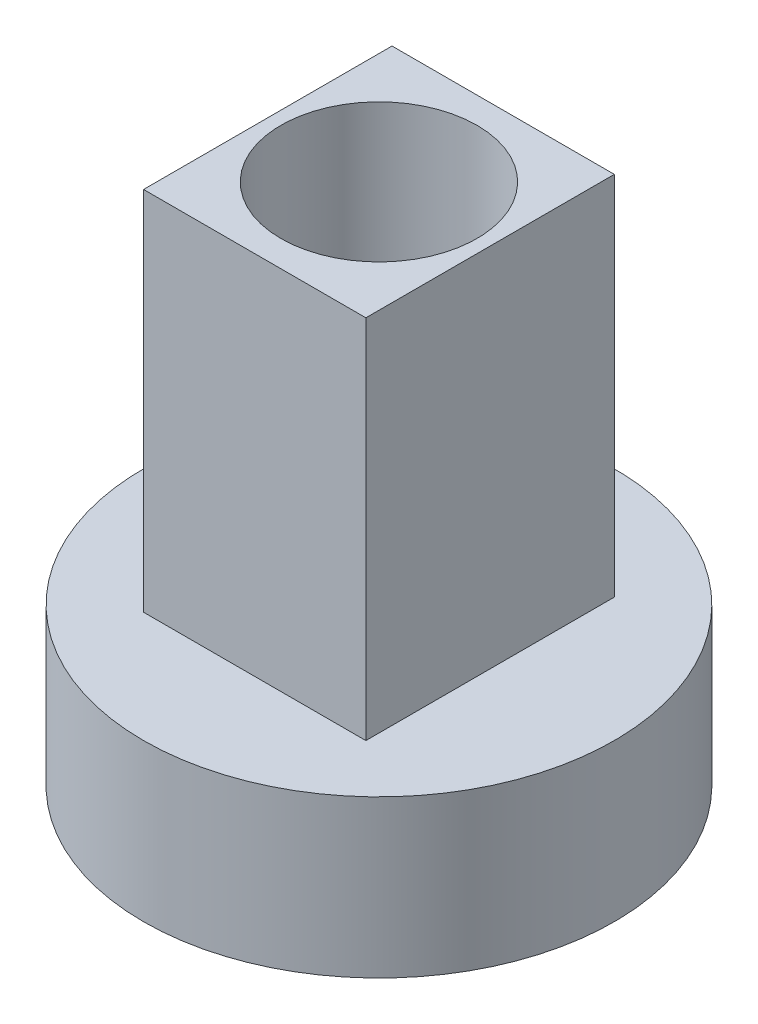
from build123d import *
from build123d.topology import SkipClean

# Parameters (mm, degrees)
SKETCH_2_R            = 90
EXTRUDE_322_DEPTH     = 60
SKETCH_4_W            = 85
SKETCH_4_H            = 95
EXTRUDE_427_DEPTH     = 140
SKETCH_5_R            = 37.5
CUT_EXTRUDE_549_DEPTH = 238.065391823
SHELL_596_OUTLINE_R   = 87
SHELL_596_OUTLINE_R_2 = 40.5
SHELL_596_DEPTH       = 57
SHELL_START           = 57
SHELL_596_2_DEPTH     = 140


# Read off the part's stored shape, not the designer's step: Оболочка
with BuildPart() as part:
    # Эскиз2 → Extrude 322 (new body)
    with BuildSketch(Plane(origin=(0, 0, 0), x_dir=(1, 0, 0), z_dir=(0, 1, 0))):
        with Locations(Location((0, 0, 0), (0, 0, 270))):
            Circle(SKETCH_2_R)
    extrude(amount=EXTRUDE_322_DEPTH)

    # Эскиз4 → Extrude 427 (add)
    with BuildSketch(Plane(origin=(0, 60, 0), x_dir=(1, 0, 0), z_dir=(0, 1, 0))):
        Rectangle(SKETCH_4_W, SKETCH_4_H)
    extrude(amount=EXTRUDE_427_DEPTH)

    # Эскиз5 → Cut-Extrude 549 (cut, through all)
    with BuildSketch(Plane(origin=(0, 200, 0), x_dir=(1, 0, 0), z_dir=(0, 1, 0))):
        with Locations(Location((0, 0, 0), (0, 0, 270))):
            Circle(SKETCH_5_R)
    extrude(amount=-CUT_EXTRUDE_549_DEPTH, mode=Mode.SUBTRACT)

    # Shell 596 outline → Shell 596 (cut)
    with BuildSketch(Plane(origin=(0, 0, 0), x_dir=(1, 0, 0), z_dir=(0, 1, 0))):
        Circle(SHELL_596_OUTLINE_R)
        Circle(SHELL_596_OUTLINE_R_2, mode=Mode.SUBTRACT)
    extrude(amount=SHELL_596_DEPTH, mode=Mode.SUBTRACT)

    # Shell 596 2 outline → Shell 596 2 (cut)
    with SkipClean():  # the faces are left unmerged after this step: merging them gives an invalid solid
        with BuildSketch(Plane(origin=(0, 0, 0), x_dir=(1, 0, 0), z_dir=(0, 1, 0)).offset(SHELL_START)):
            with BuildLine():
                ThreePointArc((-39.5, 8.94427191), (0, 40.5), (39.5, 8.94427191))
                Line((39.5, 8.94427191), (39.5, 44.5))
                Line((39.5, 44.5), (-39.5, 44.5))
                Line((-39.5, 44.5), (-39.5, 8.94427191))
            make_face()
            with BuildLine():
                Line((39.5, -44.5), (39.5, -8.94427191))
                ThreePointArc((39.5, -8.94427191), (0, -40.5), (-39.5, -8.94427191))
                Line((-39.5, -8.94427191), (-39.5, -44.5))
                Line((-39.5, -44.5), (39.5, -44.5))
            make_face()
        extrude(amount=SHELL_596_2_DEPTH, mode=Mode.SUBTRACT)


solid = part.part
